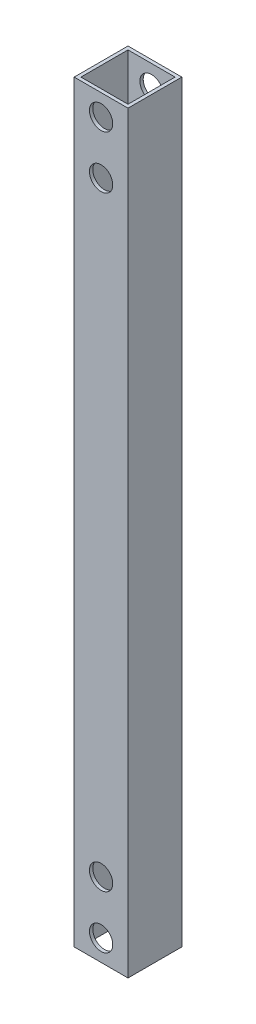
from build123d import *

# Parameters (mm, degrees)
SKETCH1_W                       = 25.4
SKETCH1_H                       = 25.4
SKETCH1_W_2                     = 22.225
SKETCH1_H_2                     = 22.225
EXTRUDE_THIN1_DEPTH             = 355.6
M10_CLEARANCE_HOLE1_D           = 11
M10_CLEARANCE_HOLE1_CSINK_D     = 11.05
M10_CLEARANCE_HOLE1_CSINK_ANGLE = 90


with BuildPart() as part:
    # Sketch1 → Extrude-Thin1 (new body)
    with BuildSketch(Plane(origin=(0, 0, 0), x_dir=(1, 0, 0), z_dir=(0, 1, 0))):
        Rectangle(SKETCH1_W, SKETCH1_H)
        Rectangle(SKETCH1_W_2, SKETCH1_H_2, mode=Mode.SUBTRACT)
    extrude(amount=EXTRUDE_THIN1_DEPTH)

    # M10 Clearance Hole1 (through all)
    with Locations(Plane(origin=(0, 0, -12.7), x_dir=(-1, 0, 0), z_dir=(0, 0, -1))):
        with Locations((0, 345.6), (0, 320.6), (0, 35), (0, 10)):
            CounterSinkHole(M10_CLEARANCE_HOLE1_D / 2, M10_CLEARANCE_HOLE1_CSINK_D / 2, counter_sink_angle=M10_CLEARANCE_HOLE1_CSINK_ANGLE)


solid = part.part
